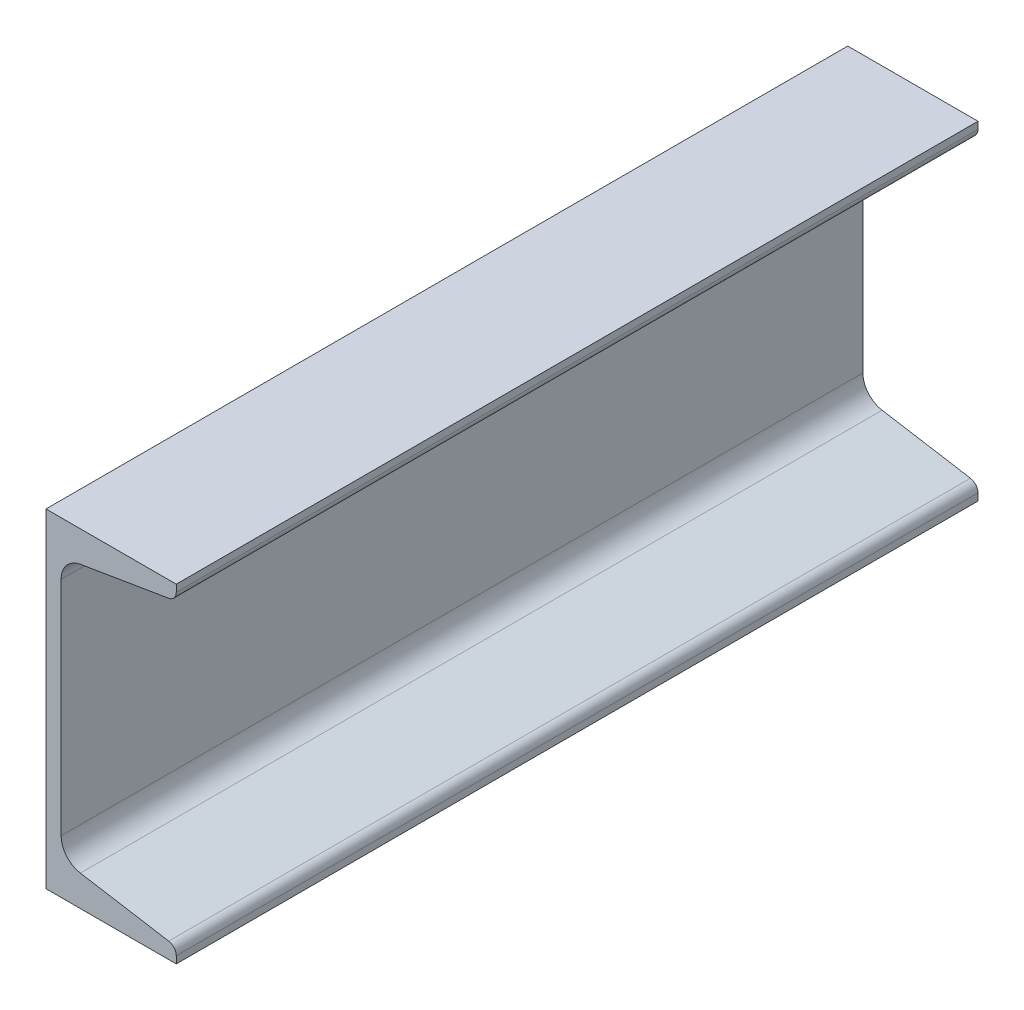
from build123d import *

# Parameters (mm, degrees)
BOSS_EXTRUDE1_DEPTH = 247.65


with BuildPart() as part:
    # Sketch1 → Boss-Extrude1 (new body)
    with BuildSketch(Plane.XY):
        with BuildLine():
            Line((0, 0), (0, 101.6))
            Line((0, 101.6), (40.2336, 101.6))
            Line((40.2336, 101.6), (40.2336, 99.411994208))
            ThreePointArc((40.2336, 99.411994208), (39.571488513, 97.606035358), (37.898963373, 96.656015019))
            Line((37.898963373, 96.656015019), (10.616311414, 92.108574647))
            ThreePointArc((10.616311414, 92.108574647), (6.358974694, 89.690341057), (4.6736, 85.093354893))
            Line((4.6736, 85.093354893), (4.6736, 16.506645107))
            ThreePointArc((4.6736, 16.506645107), (6.358974694, 11.909658943), (10.616311414, 9.491425353))
            Line((10.616311414, 9.491425353), (37.898963373, 4.943984981))
            ThreePointArc((37.898963373, 4.943984981), (39.571488513, 3.993964642), (40.2336, 2.188005792))
            Line((40.2336, 2.188005792), (40.2336, 0))
            Line((40.2336, 0), (0, 0))
        make_face()
    extrude(amount=BOSS_EXTRUDE1_DEPTH)


solid = part.part
